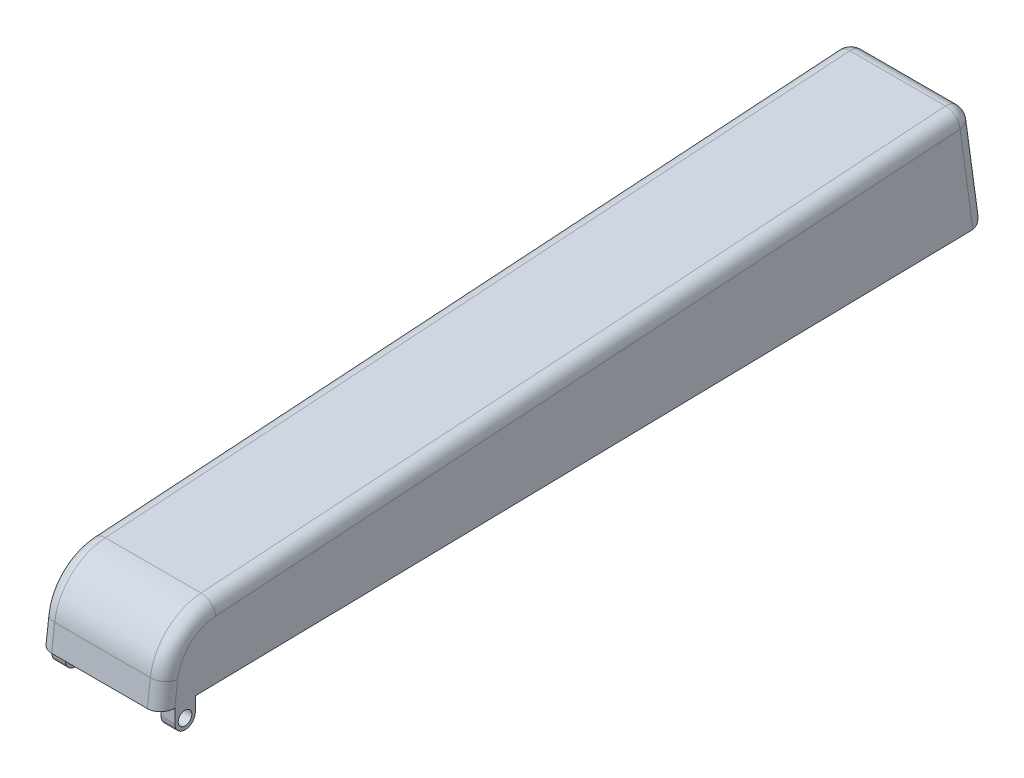
from build123d import *

# Parameters (mm, degrees)
BOSS_EXTRUDE1_DEPTH = 22.86
SHELL3_T            = -2.54
SKETCH2_R           = 1.27
BOSS_EXTRUDE2_DEPTH = 2.54
FILLET2_R           = 2.54


with BuildPart() as part:
    # Sketch1 → Boss-Extrude1 (new body)
    with BuildSketch(Plane(origin=(0, 0, 0), x_dir=(0, 0, -1), z_dir=(1, 0, 0))):
        with BuildLine():
            Line((-95.3996828, -6.597201831), (58.022669589, -3.615128074))
            Line((58.022669589, -3.615128074), (55.274818438, 16.365717982))
            Line((55.274818438, 16.365717982), (-85.421209368, 7.015665501))
            ThreePointArc((-85.421209368, 7.015665501), (-91.73681654, 4.25197608), (-94.834557989, -1.906665904))
            Line((-94.834557989, -1.906665904), (-95.3996828, -6.597201831))
        make_face()
    extrude(amount=BOSS_EXTRUDE1_DEPTH)

    # Shell3
    shell3_openings = [part.faces().sort_by_distance(p)[0] for p in [
        (11.43, -5.106164953, 18.688506605),
    ]]
    offset(amount=SHELL3_T, openings=shell3_openings, kind=Kind.INTERSECTION)

    # Sketch2 → Boss-Extrude2 (add)
    with BuildSketch(Plane(origin=(22.86, 0, 0), x_dir=(0, 0, -1), z_dir=(1, 0, 0))):
        with BuildLine():
            Line((-89.025308756, -6.473302977), (-92.835308756, -6.547358034))
            Line((-92.835308756, -6.547358034), (-92.835308756, -9.087358034))
            ThreePointArc((-92.835308756, -9.087358034), (-90.930308756, -10.992358034), (-89.025308756, -9.087358034))
            Line((-89.025308756, -9.087358034), (-89.025308756, -6.473302977))
        make_face()
        with Locations((-90.930308756, -9.087358034)):
            Circle(SKETCH2_R, mode=Mode.SUBTRACT)
    boss_extrude2 = extrude(amount=-BOSS_EXTRUDE2_DEPTH)

    # Mirror1: Boss-Extrude2 across plane
    add(boss_extrude2.mirror(Plane.ZY.offset(-11.43)))

    # Fillet2
    # the kernel refuses this fillet: 2.54 mm, written as the material it takes off along each edge
    with BuildSketch(Plane(origin=(2.54, 13.674326521, -53.081043163), x_dir=(0, 0.1362419322973002, -0.9906755956840251), z_dir=(-1, 0, 0))) as fillet2_piece_1_section:
        Polygon((0, 0), (FILLET2_R, 0), (FILLET2_R, -FILLET2_R * 0.932051833184), (FILLET2_R * 0.0702509400666, -FILLET2_R * 0.997529350656), align=None)
    fillet2_piece_1 = extrude(amount=FILLET2_R, mode=Mode.PRIVATE)
    fillet2_piece_1 = fillet2_piece_1 - Plane(origin=(2.54, 13.674326521, -53.081043163), x_dir=(0, -0.7751236084755375, 0.6318096165648808), z_dir=(-1, 0, 0)) * Sphere(FILLET2_R, mode=Mode.PRIVATE)
    add(fillet2_piece_1, mode=Mode.SUBTRACT)
    with BuildSketch(Plane(origin=(20.32, 13.674326521, -53.081043163), x_dir=(0, 0.1362419322973002, -0.9906755956840251), z_dir=(1, 0, 0))) as fillet2_piece_2_section:
        Polygon((0, 0), (FILLET2_R, 0), (FILLET2_R, FILLET2_R * 0.932051833184), (FILLET2_R * 0.0702509400666, FILLET2_R * 0.997529350656), align=None)
    fillet2_piece_2 = extrude(amount=FILLET2_R, mode=Mode.PRIVATE)
    fillet2_piece_2 = fillet2_piece_2 - Plane(origin=(20.32, 13.674326521, -53.081043163), x_dir=(0, -0.7751236084755375, 0.6318096165648808), z_dir=(1, 0, 0)) * Sphere(FILLET2_R, mode=Mode.PRIVATE)
    add(fillet2_piece_2, mode=Mode.SUBTRACT)
    with BuildSketch(Plane(origin=(0, -1.906665904, 94.834557989), x_dir=(0, -0.11961688257849476, -0.992820125401476), z_dir=(0, -0.992820125401476, 0.11961688257849475))) as fillet2_piece_3:
        with BuildLine():
            CenterArc((FILLET2_R, FILLET2_R), FILLET2_R, 180, 90)
            Line((0, FILLET2_R), (0, 0))
            Line((0, 0), (FILLET2_R, 0))
        make_face()
    extrude(amount=11.074456935, mode=Mode.SUBTRACT)
    with BuildSketch(Plane(origin=(22.86, -1.906665904, 94.834557989), x_dir=(0, -0.11961688257849476, -0.992820125401476), z_dir=(0, -0.992820125401476, 0.11961688257849475))) as fillet2_piece_4:
        with BuildLine():
            CenterArc((FILLET2_R, -FILLET2_R), FILLET2_R, 90, 90)
            Line((0, -FILLET2_R), (0, 0))
            Line((0, 0), (FILLET2_R, 0))
        make_face()
    extrude(amount=11.074456935, mode=Mode.SUBTRACT)
    with BuildSketch(Plane(origin=(0, -3.121973431, 84.747505515), x_dir=(0, 0.9977991074935991, 0.06630943435874734), z_dir=(0, 0.06630943435874734, -0.9977991074935991))) as fillet2_piece_5:
        with BuildLine():
            CenterArc((10.16 - FILLET2_R, FILLET2_R), FILLET2_R, 270, 90)
            Line((10.16, FILLET2_R), (10.16, 0))
            Line((10.16, 0), (10.16 - FILLET2_R, 0))
        make_face()
    revolve(axis=Axis((0, -3.121973431, 84.747505515), (1, 0, 0)), revolution_arc=79.327967258, mode=Mode.SUBTRACT)
    with BuildSketch(Plane(origin=(22.86, -3.121973431, 84.747505515), x_dir=(0, 0.9977991074935991, 0.06630943435874734), z_dir=(0, 0.06630943435874734, -0.9977991074935991))) as fillet2_piece_6:
        with BuildLine():
            CenterArc((10.16 - FILLET2_R, -FILLET2_R), FILLET2_R, 0, 90)
            Line((10.16, -FILLET2_R), (10.16, 0))
            Line((10.16, 0), (10.16 - FILLET2_R, 0))
        make_face()
    revolve(axis=Axis((22.86, -3.121973431, 84.747505515), (1, 0, 0)), revolution_arc=79.327967258, mode=Mode.SUBTRACT)
    with BuildSketch(Plane(origin=(-7.141741608, -3.615128074, -58.022669589), x_dir=(0, 0.9906755956840251, 0.13624193229729997), z_dir=(1, 0, 0))) as fillet2_piece_7:
        with BuildLine():
            CenterArc((FILLET2_R * 1.12468371782, FILLET2_R), FILLET2_R, 173.283078214, 96.716921786)
            Line((FILLET2_R * 0.131547569233, FILLET2_R * 1.11696405589), (0, 0))
            Line((0, 0), (FILLET2_R * 1.12468371782, 0))
        make_face()
    extrude(amount=37.143483216, mode=Mode.SUBTRACT)
    with BuildSketch(Plane(origin=(0, -9.905918107, -58.887805859), x_dir=(1, 0, 0), z_dir=(0, 0.9906755956840251, 0.1362419322973002))) as fillet2_piece_8:
        with BuildLine():
            CenterArc((FILLET2_R, -FILLET2_R), FILLET2_R, 90, 90)
            Line((0, -FILLET2_R), (0, 0))
            Line((0, 0), (FILLET2_R, 0))
        make_face()
    extrude(amount=24.151497464, mode=Mode.SUBTRACT)
    with BuildSketch(Plane(origin=(22.86, -9.905918107, -58.887805859), x_dir=(-1, 0, 0), z_dir=(0, 0.9906755956840251, 0.1362419322973002))) as fillet2_piece_9:
        with BuildLine():
            CenterArc((FILLET2_R, FILLET2_R), FILLET2_R, 180, 90)
            Line((0, FILLET2_R), (0, 0))
            Line((0, 0), (FILLET2_R, 0))
        make_face()
    extrude(amount=24.151497464, mode=Mode.SUBTRACT)
    with BuildSketch(Plane(origin=(2.54, 16.365717982, -55.274818438), x_dir=(0, -0.9906755956840249, -0.13624193229730105), z_dir=(1, 0, 0))) as fillet2_piece_10:
        with BuildLine():
            CenterArc((FILLET2_R * 0.932051833184, -FILLET2_R), FILLET2_R, 90, 85.971599492)
            Line((-FILLET2_R * 0.065477517472, -FILLET2_R * 0.929749059933), (0, 0))
            Line((0, 0), (FILLET2_R * 0.932051833184, 0))
        make_face()
    extrude(amount=17.78, mode=Mode.SUBTRACT)
    with BuildSketch(Plane(origin=(0, 16.208736254, -52.9126172), x_dir=(1, 0, 0), z_dir=(0, -0.06630943435875185, 0.9977991074935989))) as fillet2_piece_11:
        with BuildLine():
            CenterArc((FILLET2_R, -FILLET2_R), FILLET2_R, 90, 90)
            Line((0, -FILLET2_R), (0, 0))
            Line((0, 0), (FILLET2_R, 0))
        make_face()
    extrude(amount=138.638956008, mode=Mode.SUBTRACT)
    with BuildSketch(Plane(origin=(22.86, 16.208736254, -52.9126172), x_dir=(-1, 0, 0), z_dir=(0, -0.06630943435875185, 0.9977991074935989))) as fillet2_piece_12:
        with BuildLine():
            CenterArc((FILLET2_R, FILLET2_R), FILLET2_R, 180, 90)
            Line((0, FILLET2_R), (0, 0))
            Line((0, 0), (FILLET2_R, 0))
        make_face()
    extrude(amount=138.638956008, mode=Mode.SUBTRACT)


solid = part.part
